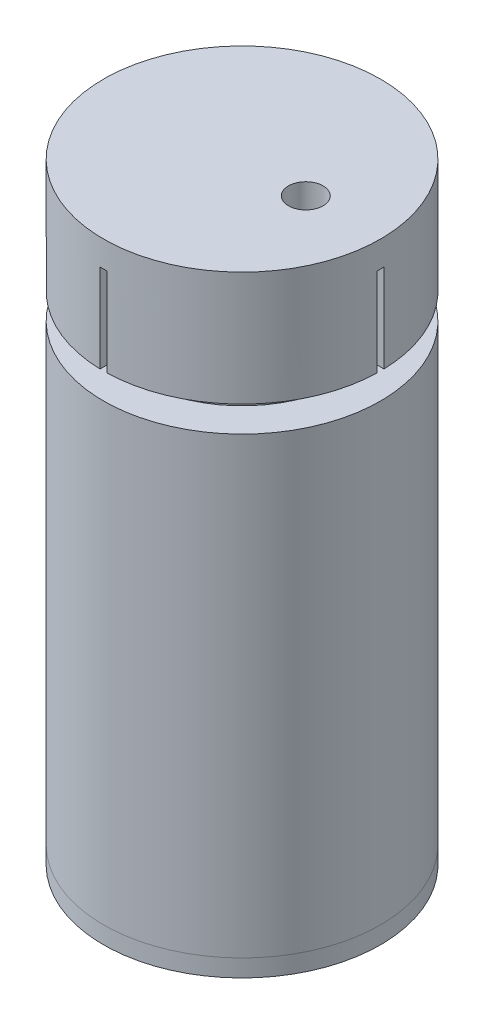
from build123d import *

# Parameters (mm, degrees)
CUT_EXTRUDE1_START      = -13.9
SKETCH2_W               = 10.8
SKETCH2_H               = 8.2
CUT_EXTRUDE1_DEPTH      = 40.621780654
CUT_EXTRUDE3_START      = -13.9
SKETCH2_3_W             = 6.3
SKETCH2_3_H             = 6.3
CUT_EXTRUDE3_DEPTH      = 5.5
SKETCH3_R               = 1
CUT_EXTRUDE4_DEPTH      = 38.068719967
CUT_EXTRUDE_THIN1_START = -5.1
SKETCH4_W               = 0.4
SKETCH4_H               = 5.00808145
SKETCH4_W_2             = 10.887021878
SKETCH4_H_2             = 0.4
SKETCH4_W_3             = 16.876138358
SKETCH4_H_3             = 7.865270954
CUT_EXTRUDE_THIN1_DEPTH = 33.8


# Read off the part's stored shape, not the designer's step: Revolve2
with BuildPart() as part:
    # Sketch1 → Revolve1 (revolve)
    with BuildSketch(Plane.XY, mode=Mode.PRIVATE) as revolve1_sk:
        Polygon((-5, 28.7), (0, 28.7), (0, 35.3), (-8, 35.3), (-8, 28.7), (-6.2, 28.7), (-6.2, 30.2), (-7, 31), (-7, 33.8), (-5, 33.8), align=None)
    revolve(revolve1_sk.sketch.rotate(Axis((0, 0, 0), (0, 1, 0)), 270), axis=Axis((0, 0, 0), (0, 1, 0)))


with BuildPart() as body_2:
    # Revolve2 outline → Revolve2 (revolve)
    with BuildSketch(Plane.XY):
        Polygon((8, 27.2), (6, 27.2), (6, 30), (6.8, 30.8), (6.8, 32.3), (5.2, 32.3), (5.2, 27.2), (0, 27.2), (0, 12.2), (5.8, 12.2), (5.8, 1), (8, 1), align=None)
    revolve(axis=Axis((0, 0, 0), (0, 1, 0)))

    # Sketch2 → Cut-Extrude1 (cut, through all)
    with BuildSketch(Plane.XZ.offset(-12.2).offset(CUT_EXTRUDE1_START)):
        Rectangle(SKETCH2_W, SKETCH2_H)
    extrude(amount=CUT_EXTRUDE1_DEPTH, mode=Mode.SUBTRACT)


with BuildPart() as body_3:
    # Sketch1<4> → Revolve3 (revolve)
    with BuildSketch(Plane.XY, mode=Mode.PRIVATE) as revolve3_sk:
        Polygon((-8, 1), (-5.65, 1), (-5.65, 2), (0, 2), (0, 0), (-8, 0), align=None)
    revolve(revolve3_sk.sketch.rotate(Axis((0, 0, 0), (0, 1, 0)), 270), axis=Axis((0, 0, 0), (0, 1, 0)))


with BuildPart() as cut_extrude3_tool:
    # Sketch2<3> → Cut-Extrude3 (new body)
    with BuildSketch(Plane.XZ.offset(-12.2).offset(CUT_EXTRUDE3_START)):
        Rectangle(SKETCH2_3_W, SKETCH2_3_H)
    extrude(amount=-CUT_EXTRUDE3_DEPTH)


with BuildPart() as part_1:
    add(part.part)

    # Cut-Extrude3: cut by cut_extrude3_tool
    add(cut_extrude3_tool.part, mode=Mode.SUBTRACT)


with BuildPart() as body_2_1:
    add(body_2.part)

    # Cut-Extrude3: cut by cut_extrude3_tool
    add(cut_extrude3_tool.part, mode=Mode.SUBTRACT)


with BuildPart() as cut_extrude4_tool:
    # Sketch3 → Cut-Extrude4 (new, through all)
    with BuildSketch(Plane(origin=(0, 35.3, 0), x_dir=(1, 0, 0), z_dir=(0, 1, 0))):
        with Locations(Location((3.68076211, 0, 0), (0, 0, 270))):
            Circle(SKETCH3_R)
    extrude(amount=-CUT_EXTRUDE4_DEPTH)


with BuildPart() as part_2:
    add(part_1.part)

    # Cut-Extrude4: cut by cut_extrude4_tool
    add(cut_extrude4_tool.part, mode=Mode.SUBTRACT)

    # Sketch4 → Cut-Extrude-Thin1 (cut)
    with BuildSketch(Plane.XZ.offset(-28.7).offset(CUT_EXTRUDE_THIN1_START)):
        with Locations((0, 7.504040725)):
            Rectangle(SKETCH4_W, SKETCH4_H)
        with Locations((-10.443510939, 0)):
            Rectangle(SKETCH4_W_2, SKETCH4_H_2)
        with Locations((13.438069179, 0)):
            Rectangle(SKETCH4_W_3, SKETCH4_H_2)
        with Locations((0, -8.932635477)):
            Rectangle(SKETCH4_W, SKETCH4_H_3)
    extrude(amount=CUT_EXTRUDE_THIN1_DEPTH, mode=Mode.SUBTRACT)


with BuildPart() as body_2_2:
    add(body_2_1.part)

    # Cut-Extrude4: cut by cut_extrude4_tool
    add(cut_extrude4_tool.part, mode=Mode.SUBTRACT)


with BuildPart() as body_3_1:
    add(body_3.part)

    # Cut-Extrude4: cut by cut_extrude4_tool
    add(cut_extrude4_tool.part, mode=Mode.SUBTRACT)


solid = Compound([part_2.part, body_2_2.part, body_3_1.part])
